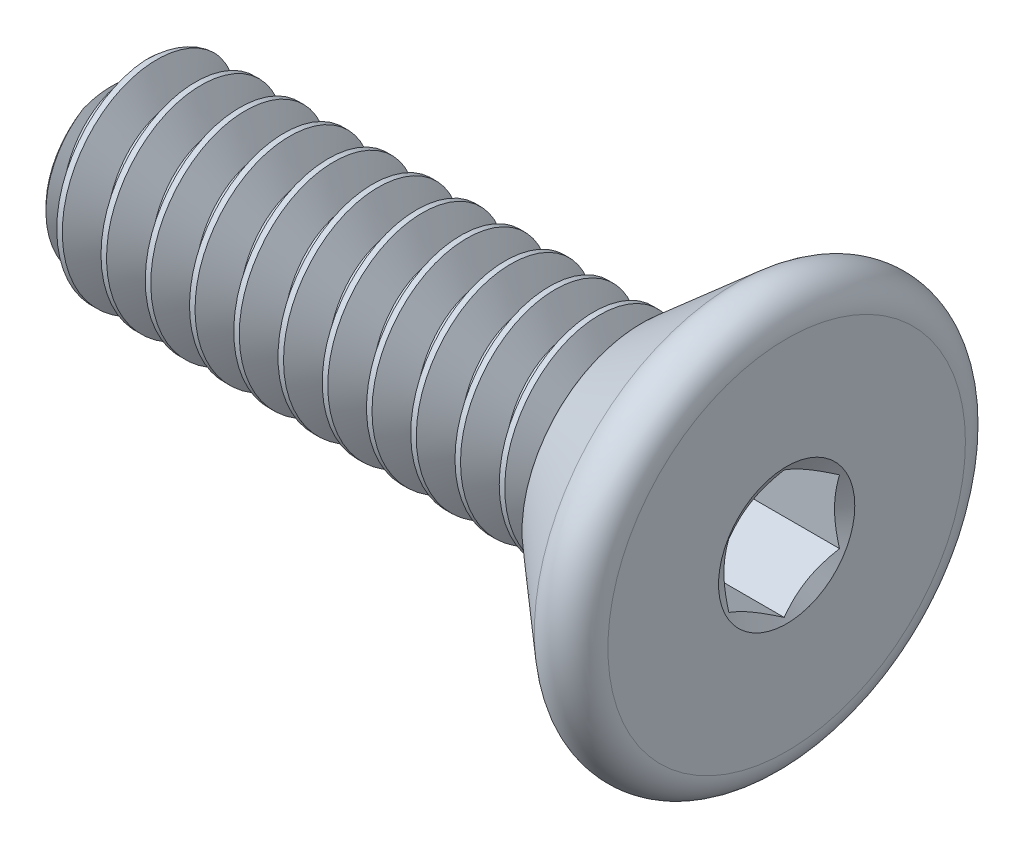
from build123d import *

# Parameters (mm, degrees)
CUT_EXTRUDE1_DEPTH = 1.397
CUT_SWEEP1_PITCH   = 0.635
CUT_SWEEP1_TO      = 7.4168


with BuildPart() as part:
    # Sketch3 → Revolve1 (revolve)
    with BuildSketch(Plane.XY, mode=Mode.PRIVATE) as revolve1_sk:
        with BuildLine():
            Line((-4.445, 1.4224), (-4.7625, 1.1049))
            Line((-4.7625, 1.1049), (-4.7625, 0))
            Line((-4.7625, 0), (4.7625, 0))
            Line((4.7625, 0), (4.7625, 2.56547008))
            ThreePointArc((4.7625, 2.56547008), (4.506088862, 2.964105841), (4.037013793, 2.896093192))
            Line((4.037013793, 2.896093192), (2.692355993, 1.7272))
            ThreePointArc((2.692355993, 1.7272), (2.664262504, 1.689578256), (2.6543, 1.643693745))
            Line((2.6543, 1.643693745), (2.6543, 1.533046873))
            ThreePointArc((2.6543, 1.533046873), (2.621892281, 1.454807719), (2.543653127, 1.4224))
            Line((2.543653127, 1.4224), (-4.445, 1.4224))
        make_face()
    revolve(revolve1_sk.sketch.rotate(Axis((4.7625, 0, 0), (-1, 0, 0)), 90), axis=Axis((4.7625, 0, 0), (-1, 0, 0)))

    # Sketch4 → Cut-Extrude1 (cut)
    with BuildSketch(Plane(origin=(4.7625, 0, 0), x_dir=(0, 0, -1), z_dir=(1, 0, 0))):
        Polygon((0, 0.916543552), (-0.79375, 0.458271776), (-0.79375, -0.458271776), (0, -0.916543552), (0.79375, -0.458271776), (0.79375, 0.458271776), align=None)
    extrude(amount=-CUT_EXTRUDE1_DEPTH, mode=Mode.SUBTRACT)

    # Cut-Extrude2 cone 1 section (through the dimple's axis) → Cut-Extrude2 (revolve, cut)
    with BuildSketch(Plane(origin=(4.7625, 0, 0), x_dir=(0, 0, -1), z_dir=(0, 1, 0))):
        Polygon((0, 0), (0.977940329, 0), (0, 0.564614112), align=None)
    revolve(axis=Axis((4.7625, 0, 0), (-1, 0, 0)), mode=Mode.SUBTRACT)

    # Cut-Extrude3 cone 1 section (through the dimple's axis) → Cut-Extrude3 (revolve, cut)
    with BuildSketch(Plane(origin=(3.3655, 0, 0), x_dir=(0, 0, -1), z_dir=(0, 1, 0))):
        Polygon((0, 0), (0.79375, 0), (0, 0.458271776), align=None)
    revolve(axis=Axis((3.3655, 0, 0), (-1, 0, 0)), mode=Mode.SUBTRACT)


with BuildPart() as body_2:
    # Split1: read off the stored shape, not the designer's step
    # Split1: the piece on the far side of the plane
    add(part.part)
    split(bisect_by=Plane.YZ.offset(2.6543), keep=Keep.BOTTOM)

    # Cut-Sweep1: arcs per turn and ends read off the stored shape
    # Cut-Sweep1: the profile of Sketch7 screwed along a right-hand helix through 15 turns, 6 arcs to a turn; built about Z, then put on its axis
    cut_sweep1_z = Axis((0, 0, 0), (0, 0, 1))
    cut_sweep1_corners = [(1.009955401, 0, -0.3175), (1.456770383, 0, -0.57546875), (1.456770383, 0, 0.01984375), (1.009955401, 0, -0.238125)]
    with BuildLine(mode=Mode.PRIVATE) as cut_sweep1_profile:
        Line(cut_sweep1_corners[0], cut_sweep1_corners[1])
        Line(cut_sweep1_corners[1], cut_sweep1_corners[2])
        Line(cut_sweep1_corners[2], cut_sweep1_corners[3])
        Line(cut_sweep1_corners[3], cut_sweep1_corners[0])
    cut_sweep1_cap = Face(cut_sweep1_profile.wire())
    cut_sweep1_turn_angles = [0, 30, 60, 90, 120, 150, 180, 210, 240, 270, 300, 330, 360]
    cut_sweep1_turn_weights = [1, 0.8660254037844387, 1, 0.8660254037844387, 1, 0.8660254037844387, 1, 0.8660254037844387, 1, 0.8660254037844387, 1, 0.8660254037844387, 1]
    cut_sweep1_turn_rails = [Edge.make_bspline([Vector(p[0], p[1], 0).rotate(cut_sweep1_z, cut_sweep1_turn_angles[k]) / cut_sweep1_turn_weights[k] + Vector(0, 0, p[2] + CUT_SWEEP1_PITCH * cut_sweep1_turn_angles[k] / 360) for k in range(13)], [0, 0, 0, 1, 1, 2, 2, 3, 3, 4, 4, 5, 5, 6, 6, 6], 2, cut_sweep1_turn_weights) for p in cut_sweep1_corners]
    cut_sweep1_turn_sides = [Face.make_surface_from_curves(cut_sweep1_turn_rails[p[0]], cut_sweep1_turn_rails[p[1]]) for p in [(0, 1), (1, 2), (2, 3), (3, 0)]]
    cut_sweep1 = Plane(origin=(-4.7625, 0, 0), x_dir=(0, -1, 0), z_dir=(1, 0, 0)) * split(Solid(Shell([*[p.moved(Location((0, 0, CUT_SWEEP1_PITCH * i))) for i in range(15) for p in cut_sweep1_turn_sides], cut_sweep1_cap, cut_sweep1_cap.rotate(cut_sweep1_z, 5400).moved(Location((0, 0, CUT_SWEEP1_PITCH * 5400 / 360)))])), bisect_by=Plane.XY.offset(CUT_SWEEP1_TO), keep=Keep.BOTTOM, mode=Mode.PRIVATE)
    add(cut_sweep1, mode=Mode.SUBTRACT)


with BuildPart() as part_1:
    add(part.part)

    # Split1
    split(bisect_by=Plane.YZ.offset(2.6543), keep=Keep.TOP)


with BuildPart() as body_2_1:
    add(body_2.part)

    # Combine1: union part
    add(part_1.part)


solid = body_2_1.part
